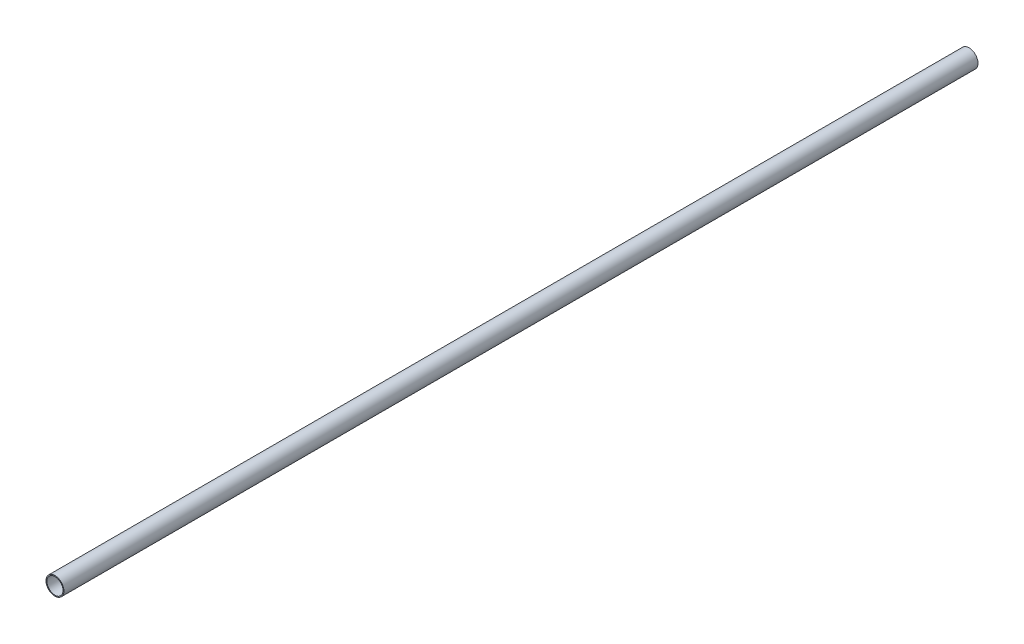
from build123d import *

# Parameters (mm, degrees)
BOSS_EXTRUDE1_DEPTH      = 311.15
BOSS_EXTRUDE1_DEPTH_BACK = 12.7
SKETCH1_R                = 3.175
SKETCH1_R_2              = 2.8575


with BuildPart() as part:
    # Sketch1 → Boss-Extrude1 (new, two sides: drawn at the far end of the back side and taken through both)
    with BuildSketch(Plane.XY.offset(-BOSS_EXTRUDE1_DEPTH_BACK)):
        Circle(SKETCH1_R)
        Circle(SKETCH1_R_2, mode=Mode.SUBTRACT)
    extrude(amount=BOSS_EXTRUDE1_DEPTH + BOSS_EXTRUDE1_DEPTH_BACK)


solid = part.part
